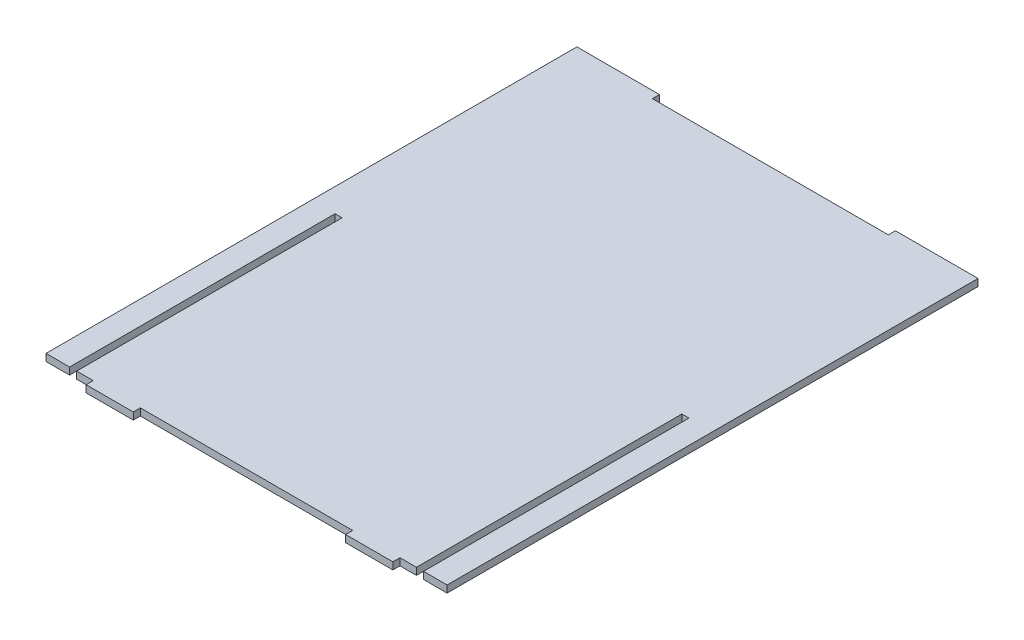
from build123d import *

# Parameters (mm, degrees)
BOSS_EXTRUDE1_DEPTH = 6
SKETCH2_W           = 6
SKETCH2_H           = 225
CUT_EXTRUDE1_DEPTH  = 6
LPATTERN1_COUNT     = 2
LPATTERN1_PITCH     = 294
SKETCH3_W           = 200
SKETCH3_H           = 6
CUT_EXTRUDE2_DEPTH  = 6


with BuildPart() as part:
    # Sketch1 → Boss-Extrude1 (new body)
    with BuildSketch(Plane(origin=(0, 0, 0), x_dir=(1, 0, 0), z_dir=(0, 1, 0))):
        Polygon((300, 0), (300, -6), (260, -6), (260, 0), (80, 0), (80, -6), (40, -6), (40, 0), (0, 0), (0, 450), (340, 450), (340, 0), align=None)
    extrude(amount=BOSS_EXTRUDE1_DEPTH)

    # Sketch2 → Cut-Extrude1 (cut)
    with BuildSketch(Plane(origin=(0, 6, 0), x_dir=(1, 0, 0), z_dir=(0, 1, 0))):
        with Locations((23, 112.5)):
            Rectangle(SKETCH2_W, SKETCH2_H)
    cut_extrude1 = extrude(amount=-CUT_EXTRUDE1_DEPTH, mode=Mode.SUBTRACT)

    # LPattern1: Cut-Extrude1 ×2
    with Locations(*[(i * LPATTERN1_PITCH, 0, 0) for i in range(1, LPATTERN1_COUNT)]):
        add(cut_extrude1, mode=Mode.SUBTRACT)

    # Sketch3 → Cut-Extrude2 (cut)
    with BuildSketch(Plane(origin=(0, 6, 0), x_dir=(1, 0, 0), z_dir=(0, 1, 0))):
        with Locations((170, 447)):
            Rectangle(SKETCH3_W, SKETCH3_H)
    extrude(amount=-CUT_EXTRUDE2_DEPTH, mode=Mode.SUBTRACT)


solid = part.part
